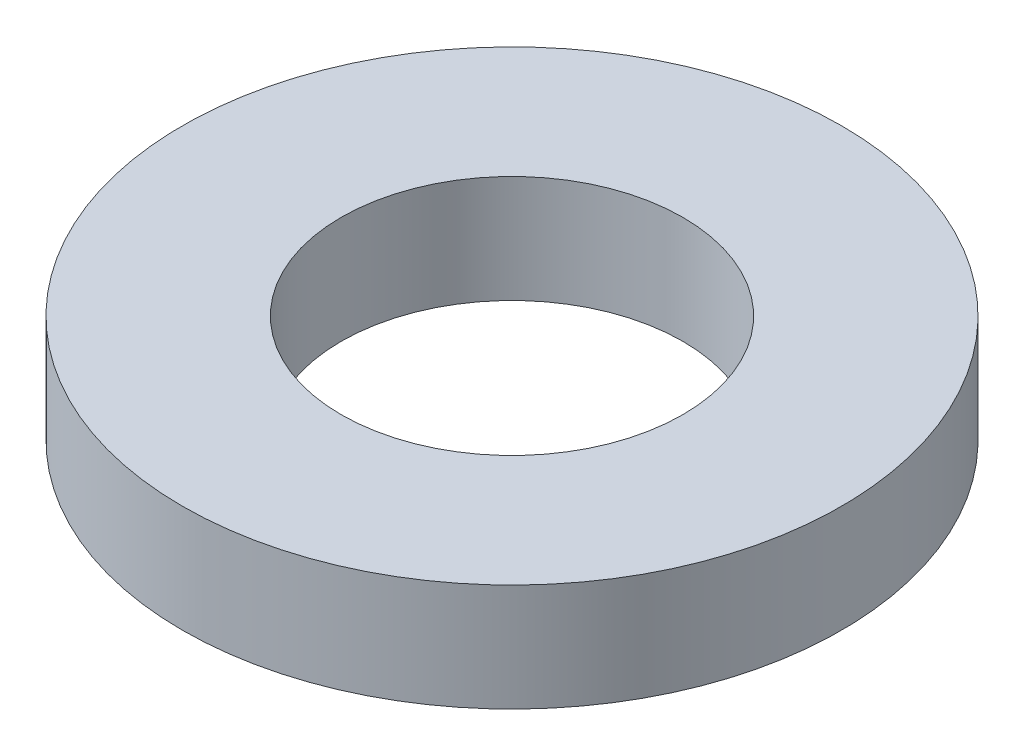
from build123d import *

# Parameters (mm, degrees)
SKETCH1_R           = 67.5
BOSS_EXTRUDE1_DEPTH = 22
SKETCH2_R           = 35
CUT_EXTRUDE1_DEPTH  = 98.96172722


with BuildPart() as part:
    # Sketch1 → Boss-Extrude1 (new body)
    with BuildSketch(Plane(origin=(0, 0, 0), x_dir=(1, 0, 0), z_dir=(0, 1, 0))):
        Circle(SKETCH1_R)
    extrude(amount=BOSS_EXTRUDE1_DEPTH)

    # Sketch2 → Cut-Extrude1 (cut, through all)
    with BuildSketch(Plane(origin=(0, 0, 0), x_dir=(1, 0, 0), z_dir=(0, 1, 0))):
        Circle(SKETCH2_R)
    extrude(amount=CUT_EXTRUDE1_DEPTH, mode=Mode.SUBTRACT)


solid = part.part
